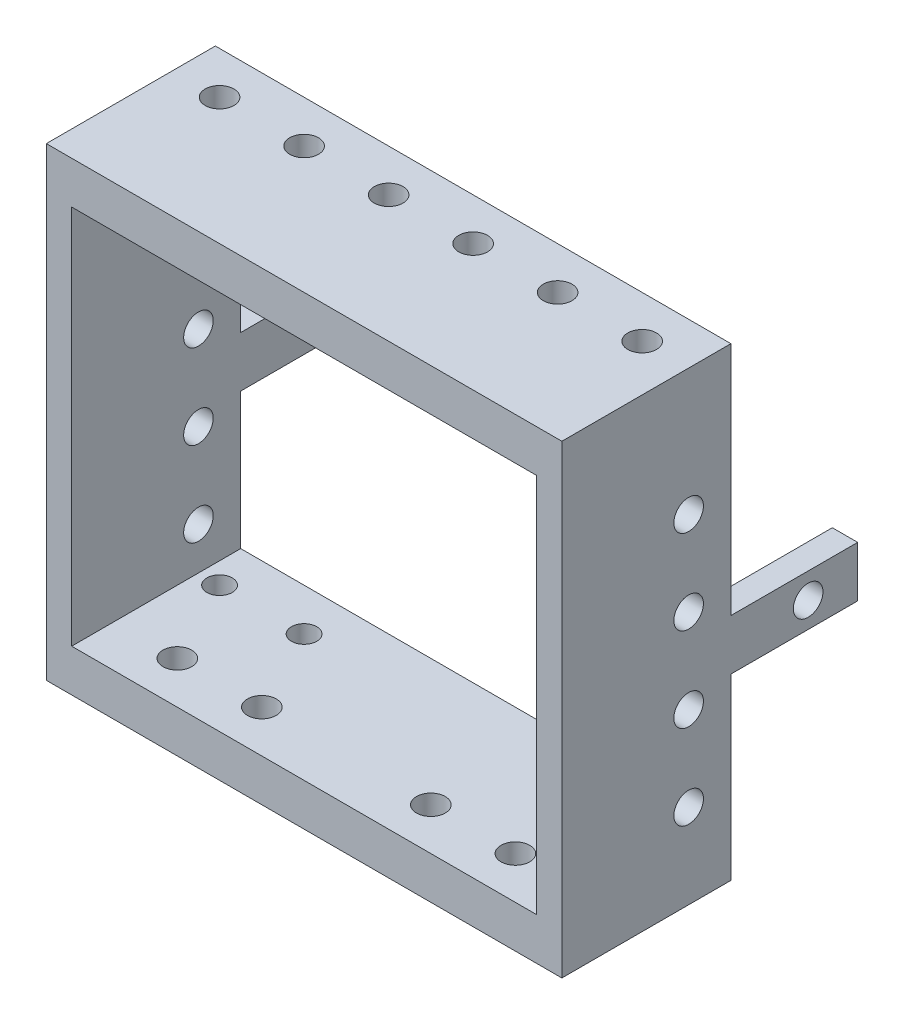
from build123d import *

# Parameters (mm, degrees)
SKETCH1_W           = 61
SKETCH1_H           = 10
SKETCH1_R           = 1.5
BOSS_EXTRUDE1_DEPTH = 5
SKETCH2_W           = 3
SKETCH2_H           = 10
BOSS_EXTRUDE2_DEPTH = 45
SKETCH3_R           = 1.75
CUT_EXTRUDE1_DEPTH  = 80.072172407
SKETCH4_W           = 15
SKETCH4_H           = 6
BOSS_EXTRUDE3_DEPTH = 3
SKETCH5_R           = 1.75
CUT_EXTRUDE2_DEPTH  = 82.52017035
SKETCH6_W           = 61
SKETCH6_H           = 10
SKETCH6_R           = 1.7
BOSS_EXTRUDE4_DEPTH = 5
SKETCH7_R           = 1.75
CUT_EXTRUDE3_DEPTH  = 85.679030308
SKETCH8_W           = 61
SKETCH8_H           = 55
SKETCH8_W_2         = 55
SKETCH8_H_2         = 45
BOSS_EXTRUDE5_DEPTH = 10
SKETCH13_R          = 1.7
CUT_EXTRUDE5_DEPTH  = 18


with BuildPart() as part:
    # Sketch1 → Boss-Extrude1 (new body)
    with BuildSketch(Plane(origin=(0, 0, 0), x_dir=(1, 0, 0), z_dir=(0, 1, 0))):
        with Locations((7.144615438, 0.604324155)):
            Rectangle(SKETCH1_W, SKETCH1_H)
        with Locations((-17.855384562, 0.604324155)):
            Circle(SKETCH1_R, mode=Mode.SUBTRACT)
        with Locations((-7.855384562, 0.604324155)):
            Circle(SKETCH1_R, mode=Mode.SUBTRACT)
        with Locations((22.144615438, 0.604324155)):
            Circle(SKETCH1_R, mode=Mode.SUBTRACT)
        with Locations((32.144615438, 0.604324155)):
            Circle(SKETCH1_R, mode=Mode.SUBTRACT)
    extrude(amount=BOSS_EXTRUDE1_DEPTH)

    # Sketch2 → Boss-Extrude2 (add)
    with BuildSketch(Plane(origin=(0, 5, 0), x_dir=(1, 0, 0), z_dir=(0, 1, 0))):
        with Locations((36.144615438, 0.604324155)):
            Rectangle(SKETCH2_W, SKETCH2_H)
        with Locations((-21.855384562, 0.604324155)):
            Rectangle(SKETCH2_W, SKETCH2_H)
    extrude(amount=BOSS_EXTRUDE2_DEPTH)

    # Sketch3 → Cut-Extrude1 (cut, through all)
    with BuildSketch(Plane.ZY.offset(23.355384562)):
        with Locations((-0.604324155, 10)):
            Circle(SKETCH3_R)
    extrude(amount=-CUT_EXTRUDE1_DEPTH, mode=Mode.SUBTRACT)

    # Sketch4 → Boss-Extrude3 (add)
    with BuildSketch(Plane.ZY.offset(23.355384562)):
        with Locations((-13.104324155, 24.14)):
            Rectangle(SKETCH4_W, SKETCH4_H)
    boss_extrude3 = extrude(amount=-BOSS_EXTRUDE3_DEPTH)

    # Mirror1: Boss-Extrude3 across plane
    add(boss_extrude3.mirror(Plane.ZY.offset(-7.144615438)))

    # Sketch5 → Cut-Extrude2 (cut, through all)
    with BuildSketch(Plane.ZY.offset(23.355384562)):
        with Locations((-14.744324155, 24.14)):
            Circle(SKETCH5_R)
    extrude(amount=-CUT_EXTRUDE2_DEPTH, mode=Mode.SUBTRACT)

    # Sketch6 → Boss-Extrude4 (add)
    with BuildSketch(Plane(origin=(0, 50, 0), x_dir=(1, 0, 0), z_dir=(0, 1, 0))):
        with Locations((7.144615438, 0.604324155)):
            Rectangle(SKETCH6_W, SKETCH6_H)
        with Locations((2.144615438, 0.604324155)):
            Circle(SKETCH6_R, mode=Mode.SUBTRACT)
        with Locations((12.144615438, 0.604324155)):
            Circle(SKETCH6_R, mode=Mode.SUBTRACT)
        with Locations((-7.855384562, 0.604324155)):
            Circle(SKETCH6_R, mode=Mode.SUBTRACT)
        with Locations((-17.855384562, 0.604324155)):
            Circle(SKETCH6_R, mode=Mode.SUBTRACT)
        with Locations((22.144615438, 0.604324155)):
            Circle(SKETCH6_R, mode=Mode.SUBTRACT)
        with Locations((32.144615438, 0.604324155)):
            Circle(SKETCH6_R, mode=Mode.SUBTRACT)
    extrude(amount=BOSS_EXTRUDE4_DEPTH)

    # Sketch7 → Cut-Extrude3 (cut, through all)
    with BuildSketch(Plane.ZY.offset(23.355384562)):
        with Locations((-0.604324155, 10)):
            Circle(SKETCH7_R)
        with Locations((-0.604324155, 20)):
            Circle(SKETCH7_R)
        with Locations((-0.604324155, 30)):
            Circle(SKETCH7_R)
        with Locations((-0.604324155, 40)):
            Circle(SKETCH7_R)
    extrude(amount=-CUT_EXTRUDE3_DEPTH, mode=Mode.SUBTRACT)

    # Sketch8 → Boss-Extrude5 (add)
    with BuildSketch(Plane.XY.offset(4.395675845)):
        with Locations((7.144615438, 27.5)):
            Rectangle(SKETCH8_W, SKETCH8_H)
        with Locations((7.144615438, 27.5)):
            Rectangle(SKETCH8_W_2, SKETCH8_H_2, mode=Mode.SUBTRACT)
    extrude(amount=BOSS_EXTRUDE5_DEPTH)

    # Sketch13 → Cut-Extrude5 (cut)
    with BuildSketch(Plane.XZ):
        with Locations((-2.855384562, 9.395675845)):
            Circle(SKETCH13_R)
        with Locations((-12.855384562, 9.395675845)):
            Circle(SKETCH13_R)
        with Locations((17.144615438, 9.395675845)):
            Circle(SKETCH13_R)
        with Locations((27.144615438, 9.395675845)):
            Circle(SKETCH13_R)
    extrude(amount=-CUT_EXTRUDE5_DEPTH, mode=Mode.SUBTRACT)


solid = part.part
